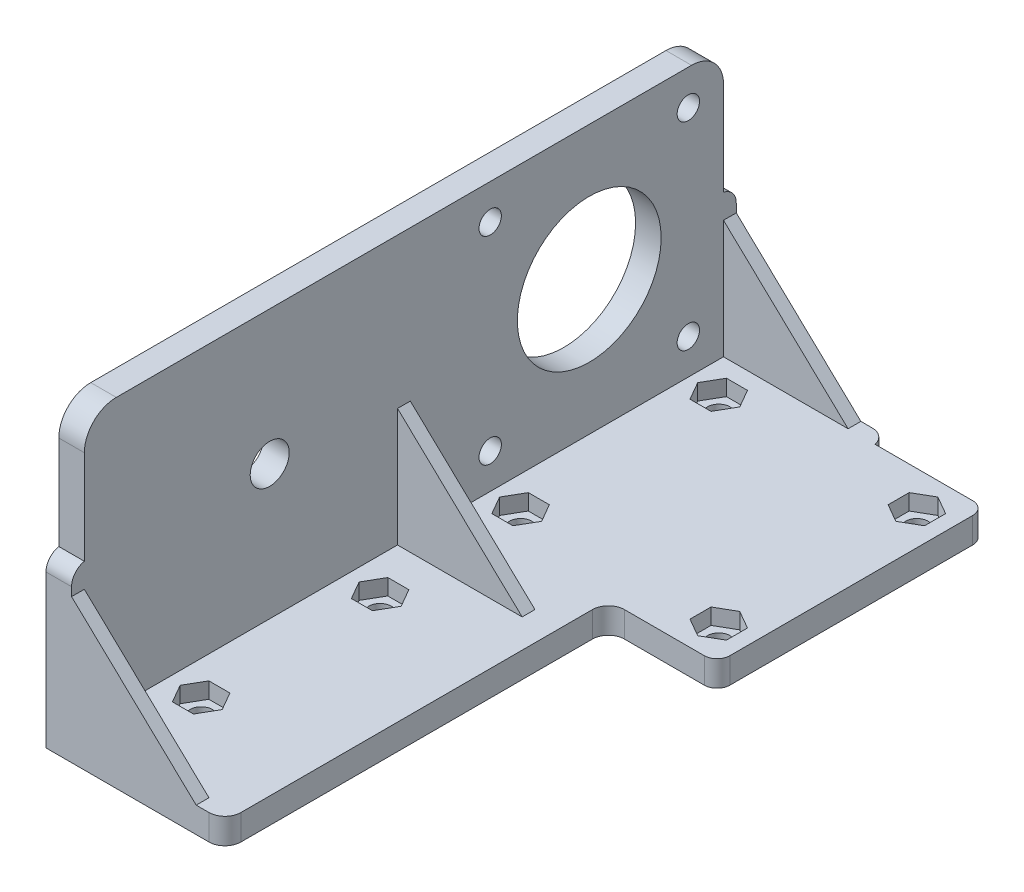
from build123d import *

# Parameters (mm, degrees)
BOSS_EXTRUDE1_DEPTH      = 2
BOSS_EXTRUDE1_DEPTH_BACK = 2
SKETCH1_R                = 1.75
SKETCH1_R_2              = 11.25
SKETCH2_W                = 42
SKETCH2_H                = 4
BOSS_EXTRUDE2_DEPTH      = 45
FILLET4_R                = 2
SKETCH3_R                = 1.75
CUT_EXTRUDE1_DEPTH       = 10
SKETCH3_4_R              = 1.75
CUT_EXTRUDE2_DEPTH       = 2.5
SKETCH10_R               = 3.05
BOSS_EXTRUDE4_DEPTH      = 4
SKETCH11_W               = 58
SKETCH11_H               = 4
BOSS_EXTRUDE5_DEPTH      = 24
SKETCH12_R               = 1.75
CUT_EXTRUDE3_DEPTH       = 24
SKETCH12_3_R             = 1.75
CUT_EXTRUDE4_DEPTH       = 2.5
FILLET5_R                = 2.5
BOSS_EXTRUDE6_DEPTH      = 2
LPATTERN1_COUNT          = 2
LPATTERN1_PITCH          = 51
FILLET6_R                = 2.5
FILLET7_R                = 2.5
FILLET7_OF_MIRROR3_R     = 2.5
SKETCH15_W               = 3.203134656
SKETCH15_H               = 5.191613013
BOSS_EXTRUDE7_DEPTH      = 4
FILLET8_R                = 2.5


with BuildPart() as part:
    # Sketch1 → Boss-Extrude1 (new, two sides: drawn at the far end of the back side and taken through both)
    with BuildSketch(Plane(origin=(0, 0, 0), x_dir=(0, 0, -1), z_dir=(1, 0, 0)).offset(-BOSS_EXTRUDE1_DEPTH_BACK)):
        with BuildLine():
            Line((-16, 21), (16, 21))
            ThreePointArc((16, 21), (19.535533906, 19.535533906), (21, 16))
            Line((21, 16), (21, -21))
            Line((21, -21), (-21, -21))
            Line((-21, -21), (-21, 16))
            ThreePointArc((-21, 16), (-19.535533906, 19.535533906), (-16, 21))
        make_face()
        with Locations((15.5, 15.5)):
            Circle(SKETCH1_R, mode=Mode.SUBTRACT)
        with Locations(Location((-15.5, 15.5, 0), (0, 0, 180))):
            Circle(SKETCH1_R, mode=Mode.SUBTRACT)
        with Locations(Location((15.5, -15.5, 0), (0, 0, 180))):
            Circle(SKETCH1_R, mode=Mode.SUBTRACT)
        with Locations((-15.5, -15.5)):
            Circle(SKETCH1_R, mode=Mode.SUBTRACT)
        Circle(SKETCH1_R_2, mode=Mode.SUBTRACT)
    extrude(amount=BOSS_EXTRUDE1_DEPTH + BOSS_EXTRUDE1_DEPTH_BACK)

    # Sketch2 → Boss-Extrude2 (add)
    with BuildSketch(Plane.ZY.offset(2)):
        with Locations((0, -23)):
            Rectangle(SKETCH2_W, SKETCH2_H)
    extrude(amount=-BOSS_EXTRUDE2_DEPTH)

    # Fillet4
    fillet4_edges = [part.edges().sort_by_distance(p)[0] for p in [
        (43, -23, -21),
        (43, -23, 21),
    ]]
    fillet(fillet4_edges, radius=FILLET4_R)

    # Sketch3 → Cut-Extrude1 (cut)
    with BuildSketch(Plane(origin=(0, -21, 0), x_dir=(1, 0, 0), z_dir=(0, 1, 0))):
        with Locations(Location((37.777001089, 15.480581557, 0), (0, 0, 270))):
            Circle(SKETCH3_R)
        with Locations(Location((37.777001089, -15.519418443, 0), (0, 0, 270))):
            Circle(SKETCH3_R)
        with Locations(Location((6.777001089, -15.519418443, 0), (0, 0, 270))):
            Circle(SKETCH3_R)
        with Locations(Location((6.777001089, 15.480581557, 0), (0, 0, 270))):
            Circle(SKETCH3_R)
    extrude(amount=-CUT_EXTRUDE1_DEPTH, mode=Mode.SUBTRACT)

    # Sketch3<4> → Cut-Extrude2 (cut)
    # profile 1 of 4: a face of its own
    with BuildSketch(Plane(origin=(0, -21, 0), x_dir=(1, 0, 0), z_dir=(0, 1, 0))):
        Polygon((37.777001089, -18.810314977), (40.627001089, -17.16486671), (40.627001089, -13.873970176), (37.777001089, -12.228521908), (34.927001089, -13.873970176), (34.927001089, -17.16486671), align=None)
        with Locations(Location((37.777001089, -15.519418443, 0), (0, 0, 270))):
            Circle(SKETCH3_4_R, mode=Mode.SUBTRACT)
    # profile 2 of 4: a face of its own
    with BuildSketch(Plane(origin=(0, -21, 0), x_dir=(1, 0, 0), z_dir=(0, 1, 0))):
        Polygon((5.131552822, -18.369418443), (8.422449356, -18.369418443), (10.067897623, -15.519418443), (8.422449356, -12.669418443), (5.131552822, -12.669418443), (3.486104555, -15.519418443), align=None)
        with Locations(Location((6.777001089, -15.519418443, 0), (0, 0, 270))):
            Circle(SKETCH3_4_R, mode=Mode.SUBTRACT)
    # profile 3 of 4: a face of its own
    with BuildSketch(Plane(origin=(0, -21, 0), x_dir=(1, 0, 0), z_dir=(0, 1, 0))):
        Polygon((40.627001089, 13.83513329), (40.627001089, 17.126029824), (37.777001089, 18.771478092), (34.927001089, 17.126029824), (34.927001089, 13.83513329), (37.777001089, 12.189685023), align=None)
        with Locations(Location((37.777001089, 15.480581557, 0), (0, 0, 270))):
            Circle(SKETCH3_4_R, mode=Mode.SUBTRACT)
    # profile 4 of 4: a face of its own
    with BuildSketch(Plane(origin=(0, -21, 0), x_dir=(1, 0, 0), z_dir=(0, 1, 0))):
        Polygon((5.131552822, 12.630581557), (8.422449356, 12.630581557), (10.067897623, 15.480581557), (8.422449356, 18.330581557), (5.131552822, 18.330581557), (3.486104555, 15.480581557), align=None)
        with Locations(Location((6.777001089, 15.480581557, 0), (0, 0, 270))):
            Circle(SKETCH3_4_R, mode=Mode.SUBTRACT)
    extrude(amount=-CUT_EXTRUDE2_DEPTH, mode=Mode.SUBTRACT)

    # Sketch10 → Boss-Extrude4 (add)
    with BuildSketch(Plane.ZY.offset(2)):
        with BuildLine():
            Line((16, 21), (21, 21))
            Line((21, 21), (74, 21))
            ThreePointArc((74, 21), (77.535533906, 19.535533906), (79, 16))
            Line((79, 16), (79, -25))
            Line((79, -25), (21, -25))
            Line((21, -25), (21, 16))
            Line((21, 16), (16, 21))
        make_face()
        with Locations((50, 0)):
            Circle(SKETCH10_R, mode=Mode.SUBTRACT)
    extrude(amount=-BOSS_EXTRUDE4_DEPTH)

    # Sketch11 → Boss-Extrude5 (add)
    with BuildSketch(Plane(origin=(2, 0, 0), x_dir=(0, 0, -1), z_dir=(1, 0, 0))):
        with Locations((-50, -23)):
            Rectangle(SKETCH11_W, SKETCH11_H)
    extrude(amount=BOSS_EXTRUDE5_DEPTH)

    # Sketch12 → Cut-Extrude3 (cut)
    with BuildSketch(Plane(origin=(0, -21, 0), x_dir=(1, 0, 0), z_dir=(0, 1, 0))):
        with Locations(Location((7.297001089, -38.019418443, 0), (0, 0, 270))):
            Circle(SKETCH12_R)
        with Locations(Location((7.297001089, -66.019418443, 0), (0, 0, 270))):
            Circle(SKETCH12_R)
    extrude(amount=-CUT_EXTRUDE3_DEPTH, mode=Mode.SUBTRACT)

    # Sketch12<3> → Cut-Extrude4 (cut)
    # profile 1 of 2: a face of its own
    with BuildSketch(Plane(origin=(0, -21, 0), x_dir=(1, 0, 0), z_dir=(0, 1, 0))):
        Polygon((5.651552822, -40.869418443), (8.942449356, -40.869418443), (10.587897623, -38.019418443), (8.942449356, -35.169418443), (5.651552822, -35.169418443), (4.006104555, -38.019418443), align=None)
        with Locations(Location((7.297001089, -38.019418443, 0), (0, 0, 270))):
            Circle(SKETCH12_3_R, mode=Mode.SUBTRACT)
    # profile 2 of 2: a face of its own
    with BuildSketch(Plane(origin=(0, -21, 0), x_dir=(1, 0, 0), z_dir=(0, 1, 0))):
        Polygon((5.651552822, -68.869418443), (8.942449356, -68.869418443), (10.587897623, -66.019418443), (8.942449356, -63.169418443), (5.651552822, -63.169418443), (4.006104555, -66.019418443), align=None)
        with Locations(Location((7.297001089, -66.019418443, 0), (0, 0, 270))):
            Circle(SKETCH12_3_R, mode=Mode.SUBTRACT)
    extrude(amount=-CUT_EXTRUDE4_DEPTH, mode=Mode.SUBTRACT)

    # Fillet5
    fillet5_edges = [part.edges().sort_by_distance(p)[0] for p in [
        (26, -23, 21),
        (26, -23, 79),
    ]]
    fillet(fillet5_edges, radius=FILLET5_R)

    # Sketch14 → Boss-Extrude6 (add)
    with BuildSketch(Plane(origin=(0, 0, -21), x_dir=(-1, 0, 0), z_dir=(0, 0, -1))):
        Polygon((-2, -2.5), (-21.5, -21), (-25.716216216, -21), (-25.716216216, -25), (2, -25), (2, 1.294871795), (-2, 1.294871795), align=None)
    boss_extrude6 = extrude(amount=BOSS_EXTRUDE6_DEPTH)

    # LPattern1: Boss-Extrude6 ×2
    with Locations(*[(0, 0, i * LPATTERN1_PITCH) for i in range(1, LPATTERN1_COUNT)]):
        add(boss_extrude6)

    # Fillet6
    # the kernel refuses this fillet: 2.5 mm, written as the material it takes off along each edge
    with BuildSketch(Plane(origin=(25.716216216, -14.876275643, -23), x_dir=(-1, 0, 0), z_dir=(0, -1, 0))) as fillet6_piece_1:
        with BuildLine():
            CenterArc((2.449489743, -2.5), FILLET6_R, 90, 78.463040967)
            Line((0, -2), (-0.048989795, -1.99))
            ThreePointArc((-0.048989795, -1.99), (-0.05, -1), (-0.05, 0))
            Line((-0.05, 0), (0, 0.05))
            Line((0, 0.05), (2.449489743, 0.05))
            Line((2.449489743, 0.05), (2.449489743, 0))
        make_face()
    extrude(amount=16.247448714, mode=Mode.SUBTRACT)

    # Fillet7
    # the kernel refuses this fillet: 2.5 mm, written as the material it takes off along each edge
    with BuildSketch(Plane(origin=(-8.123724357, 1.294871795, -23), x_dir=(0, -1, 0), z_dir=(1, 0, 0))) as fillet7_piece_1:
        with BuildLine():
            CenterArc((2.449489743, -2.5), FILLET7_R, 90, 78.463040967)
            Line((0, -2), (-0.048989795, -1.99))
            ThreePointArc((-0.048989795, -1.99), (-0.05, -1), (-0.05, 0))
            Line((-0.05, 0), (0, 0.05))
            Line((0, 0.05), (2.449489743, 0.05))
            Line((2.449489743, 0.05), (2.449489743, 0))
        make_face()
    extrude(amount=16.247448714, mode=Mode.SUBTRACT)

    # Mirror3: Boss-Extrude6 across plane
    add(boss_extrude6.mirror(Plane.XY.offset(29)))

    # Fillet7 of Mirror3
    # the kernel refuses this fillet: 2.5 mm, written as the material it takes off along each edge
    with BuildSketch(Plane(origin=(-8.123724357, 1.294871795, 81), x_dir=(0, -1.5735190928007313e-12, -1.0), z_dir=(1, 0, 0))) as fillet7_of_mirror3_piece_1:
        with BuildLine():
            CenterArc((2.5, -2.449489743), FILLET7_OF_MIRROR3_R, 101.536959033, 78.463040967)
            Line((0, -2.449489743), (-0.05, -2.449489743))
            Line((-0.05, -2.449489743), (-0.05, 0))
            Line((-0.05, 0), (0, 0.05))
            ThreePointArc((0, 0.05), (1, 0.05), (1.99, 0.048989795))
            Line((1.99, 0.048989795), (2, 0))
        make_face()
    extrude(amount=16.247448714, mode=Mode.SUBTRACT)

    # Sketch15 → Boss-Extrude7 (add)
    with BuildSketch(Plane(origin=(0, -21, 0), x_dir=(1, 0, 0), z_dir=(0, 1, 0))):
        with Locations((24.398432672, -78.404193494)):
            Rectangle(SKETCH15_W, SKETCH15_H)
    extrude(amount=-BOSS_EXTRUDE7_DEPTH)

    # Fillet8
    fillet8_edges = [part.edges().sort_by_distance(p)[0] for p in [
        (26, -23, 81),
    ]]
    fillet(fillet8_edges, radius=FILLET8_R)


solid = part.part
